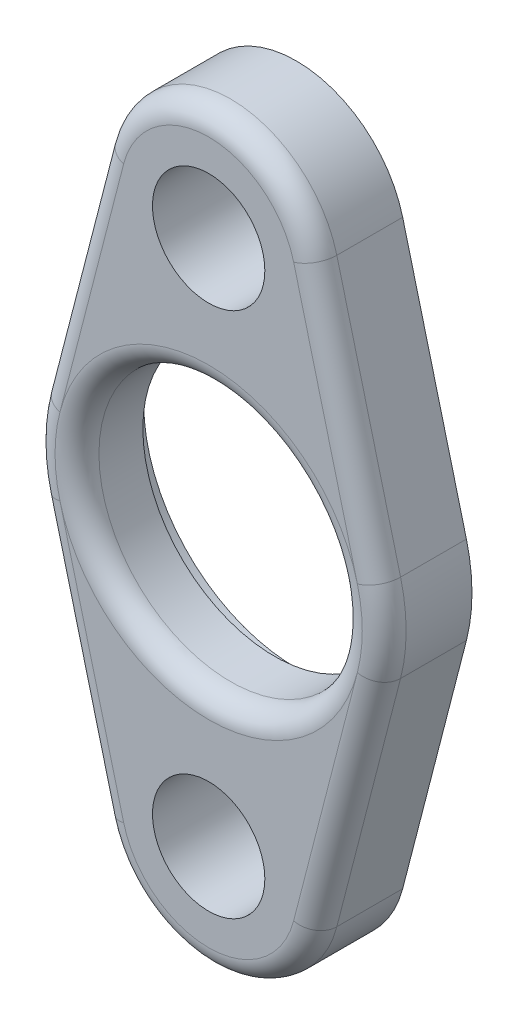
from build123d import *

# Parameters (mm, degrees)
SKETCH1_R           = 2.032
SKETCH1_R_2         = 4.7625
BOSS_EXTRUDE1_DEPTH = 3.175
SKETCH2_R           = 5.5245
CUT_EXTRUDE3_DEPTH  = 0.79375
FILLET1_R           = 0.79375


with BuildPart() as part:
    # Sketch1 → Boss-Extrude1 (new body)
    with BuildSketch(Plane.XY):
        with BuildLine():
            Line((3.842725664, -10.5171875), (6.148361062, -1.5875))
            ThreePointArc((6.148361062, -1.5875), (6.35, 0), (6.148361062, 1.5875))
            Line((6.148361062, 1.5875), (3.842725664, 10.5171875))
            ThreePointArc((3.842725664, 10.5171875), (0, 13.49375), (-3.842725664, 10.5171875))
            Line((-3.842725664, 10.5171875), (-6.148361062, 1.5875))
            ThreePointArc((-6.148361062, 1.5875), (-6.35, 0), (-6.148361062, -1.5875))
            Line((-6.148361062, -1.5875), (-3.842725664, -10.5171875))
            ThreePointArc((-3.842725664, -10.5171875), (0, -13.49375), (3.842725664, -10.5171875))
        make_face()
        with Locations((0, 9.525)):
            Circle(SKETCH1_R, mode=Mode.SUBTRACT)
        with Locations((0, -9.525)):
            Circle(SKETCH1_R, mode=Mode.SUBTRACT)
        Circle(SKETCH1_R_2, mode=Mode.SUBTRACT)
    extrude(amount=BOSS_EXTRUDE1_DEPTH)

    # Sketch2 → Cut-Extrude3 (cut)
    with BuildSketch(Plane(origin=(0, 0, 0), x_dir=(-1, 0, 0), z_dir=(0, 0, -1))):
        Circle(SKETCH2_R)
    extrude(amount=-CUT_EXTRUDE3_DEPTH, mode=Mode.SUBTRACT)

    # Fillet1
    fillet1_edges = [part.edges().sort_by_distance(p)[0] for p in [
        (6.35, 0, 3.175),
        (4.995543363, 6.05234375, 3.175),
        (0, 13.49375, 3.175),
        (-4.995543363, 6.05234375, 3.175),
        (-6.35, 0, 3.175),
        (-4.7625, 0, 3.175),
        (-4.995543363, -6.05234375, 3.175),
        (0, -13.49375, 3.175),
        (4.995543363, -6.05234375, 3.175),
    ]]
    fillet(fillet1_edges, radius=FILLET1_R - 0.0001)  # a hair under: the kernel refuses the full size


solid = part.part
